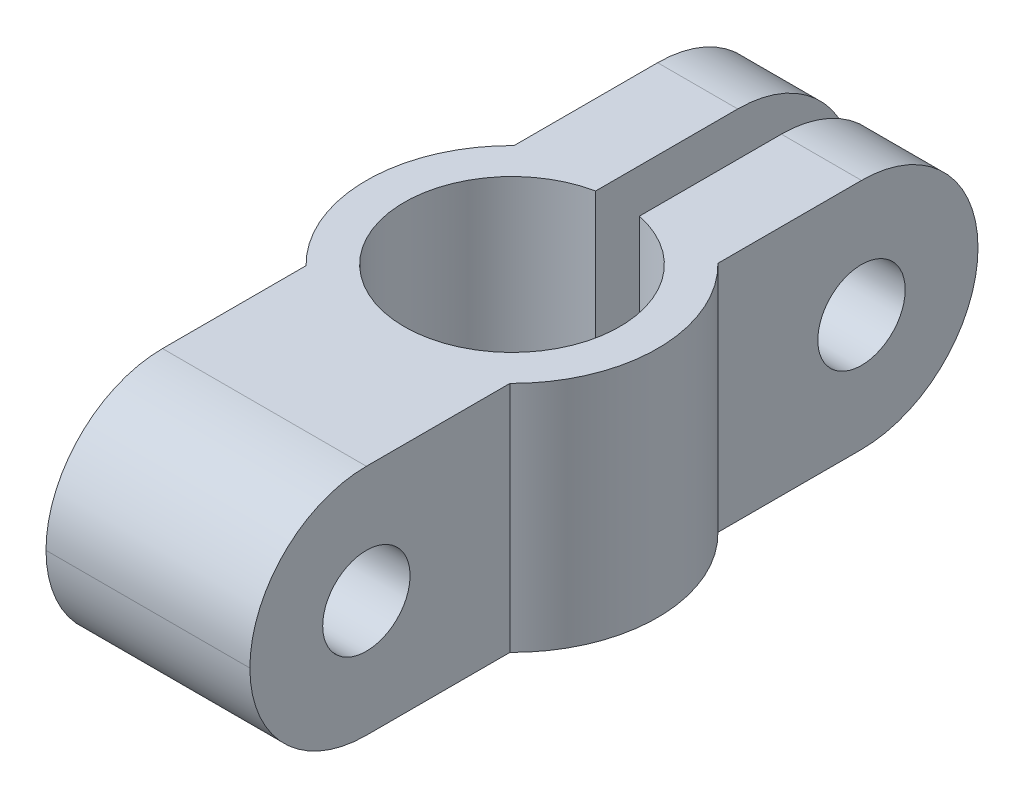
from build123d import *

# Parameters (mm, degrees)
EXTRUDE_2_DEPTH     = 8
FILLET_1_R          = 4
SKETCH_5_R          = 1.5
CUT_EXTRUDE_1_DEPTH = 18.102631376
SKETCH_3_R          = 3.7
CUT_EXTRUDE_2_DEPTH = 16.660459763
FILLET_3_R          = 4
SKETCH_6_R          = 1.5
CUT_EXTRUDE_3_DEPTH = 18.102631376
SKETCH_7_W          = 1.5
SKETCH_7_H          = 11.105726975
CUT_EXTRUDE_5_DEPTH = 10


with BuildPart() as part:
    # 草图1 → 凸台-拉伸2 (new body)
    with BuildSketch(Plane(origin=(0, 0, 0), x_dir=(1, 0, 0), z_dir=(0, 1, 0))):
        with BuildLine():
            Line((-3.5, 3.570714214), (-3.5, 12.5))
            Line((-3.5, 12.5), (3.5, 12.5))
            Line((3.5, 12.5), (3.5, 3.570714214))
            ThreePointArc((3.5, 3.570714214), (5, 0), (3.5, -3.570714214))
            Line((3.5, -3.570714214), (3.5, -12.5))
            Line((3.5, -12.5), (-3.5, -12.5))
            Line((-3.5, -12.5), (-3.5, -3.570714214))
            ThreePointArc((-3.5, -3.570714214), (-5, 0), (-3.5, 3.570714214))
        make_face()
    extrude(amount=EXTRUDE_2_DEPTH)

    # 圆角1
    fillet_1_edges = [part.edges().sort_by_distance(p)[0] for p in [
        (0, 0, -12.5),
        (0, 8, -12.5),
    ]]
    fillet(fillet_1_edges, radius=FILLET_1_R - 0.0001)  # a hair under: the kernel refuses the full size

    # 草图5 → 切除-拉伸1 (cut, through all)
    with BuildSketch(Plane(origin=(3.5, 0, 0), x_dir=(0, 0, -1), z_dir=(1, 0, 0))):
        with Locations((8.5, 4)):
            Circle(SKETCH_5_R)
    extrude(amount=-CUT_EXTRUDE_1_DEPTH, mode=Mode.SUBTRACT)

    # 草图3 → 切除-拉伸2 (cut, through all)
    with BuildSketch(Plane(origin=(0, 8, 0), x_dir=(1, 0, 0), z_dir=(0, 1, 0))):
        with Locations(Location((0, 0, 0), (0, 0, 270))):
            Circle(SKETCH_3_R)
    extrude(amount=-CUT_EXTRUDE_2_DEPTH, mode=Mode.SUBTRACT)

    # 圆角3
    fillet_3_edges = [part.edges().sort_by_distance(p)[0] for p in [
        (0, 8, 12.5),
        (0, 0, 12.5),
    ]]
    fillet(fillet_3_edges, radius=FILLET_3_R - 0.0001)  # a hair under: the kernel refuses the full size

    # 草图6 → 切除-拉伸3 (cut, through all)
    with BuildSketch(Plane.ZY.offset(3.5)):
        with Locations((8.5, 4)):
            Circle(SKETCH_6_R)
    extrude(amount=-CUT_EXTRUDE_3_DEPTH, mode=Mode.SUBTRACT)

    # 草图7 → 切除-拉伸5 (cut)
    with BuildSketch(Plane(origin=(0, 8, 0), x_dir=(1, 0, 0), z_dir=(0, 1, 0))):
        with Locations((0, 9.052863488)):
            Rectangle(SKETCH_7_W, SKETCH_7_H)
    extrude(amount=-CUT_EXTRUDE_5_DEPTH, mode=Mode.SUBTRACT)


solid = part.part
